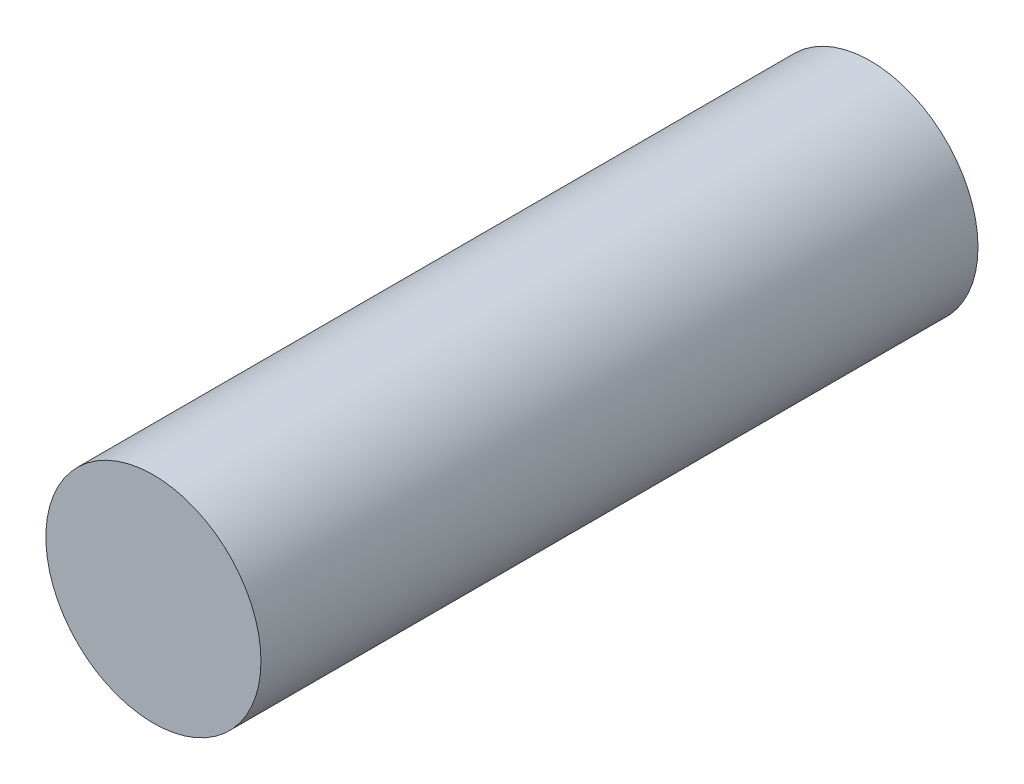
from build123d import *

# Parameters (mm, degrees)
SKETCH1_R           = 1.5
BOSS_EXTRUDE1_DEPTH = 5


with BuildPart() as part:
    # Sketch1 → Boss-Extrude1 (new, symmetric)
    with BuildSketch(Plane.XY):
        Circle(SKETCH1_R)
    extrude(amount=BOSS_EXTRUDE1_DEPTH, both=True)


solid = part.part
